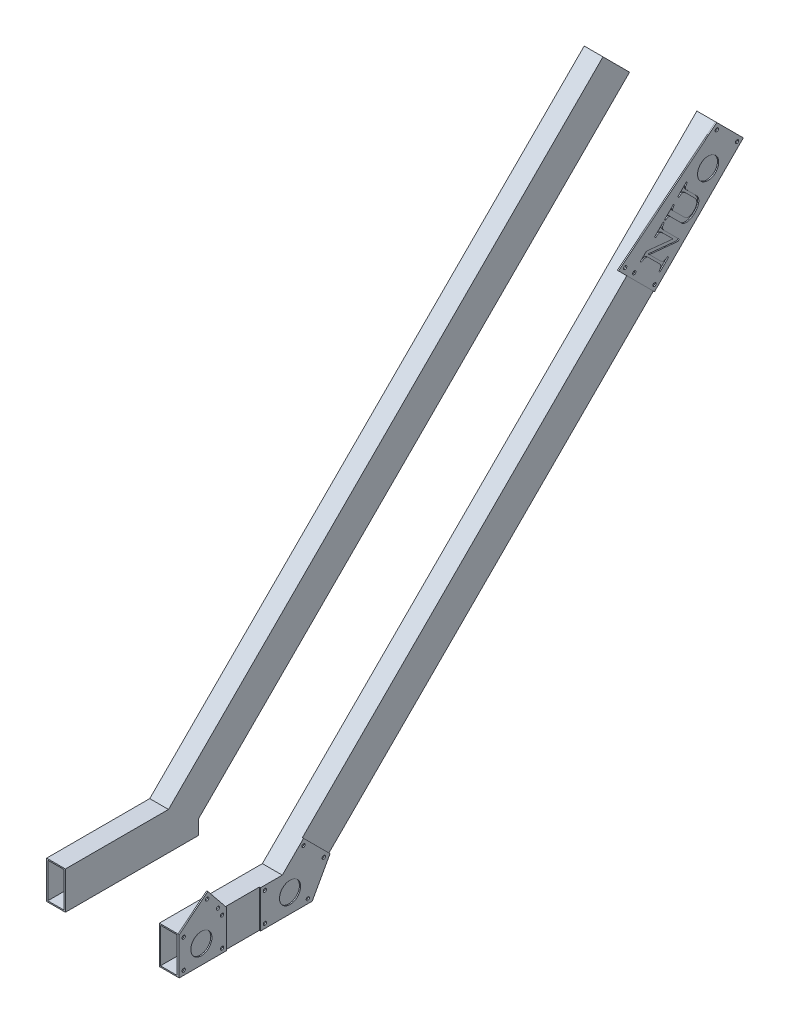
from build123d import *

# Parameters (mm, degrees)
HEEL_GUSSET_EXTRUSION_DEPTH     = 1.5875
SKETCH2_R                       = 14.2875
SKETCH2_R_2                     = 2.25
HEEL_GUSSET_CUT_EXTRUSION_DEPTH = 98
TOE_GUSSET_EXTRUSION_DEPTH      = 1.5875
SKETCH4_R                       = 14.2875
SKETCH4_R_2                     = 2.25
TOE_GUSSET_CUT_EXTRUSION_DEPTH  = 42.5875
KNEE_GUSSET_EXTRUSION_DEPTH     = 1.5875
SKETCH6_R                       = 14.2875
SKETCH6_R_2                     = 2.25
KNEE_GUSSET_CUT_EXTRUSION_DEPTH = 133.5875
BOTTOM_2X1_DEPTH                = 30
BOTTOM_2X1_DEPTH_BACK           = 150
SKETCH7_W                       = 25.4
SKETCH7_H                       = 50.8
SKETCH7_W_2                     = 22.225
SKETCH7_H_2                     = 47.625
TOP_KNEE_SHAFT_W                = 50.8
TOP_KNEE_SHAFT_H                = 25.4
TOP_KNEE_SHAFT_W_2              = 47.625
TOP_KNEE_SHAFT_H_2              = 22.225
BOSS_EXTRUDE2_DEPTH             = 850


with BuildPart() as part:
    # Sketch1 → Heel Gusset Extrusion (new body)
    with BuildSketch(Plane(origin=(88.9, 0, 0), x_dir=(0, 0, -1), z_dir=(1, 0, 0))):
        Polygon((80, -25.4), (150, -25.4), (174.145793616, 18.224769132), (138.224769132, 54.145793616), (109.478975516, 25.4), (80, 25.4), align=None)
    extrude(amount=HEEL_GUSSET_EXTRUSION_DEPTH)

    # Sketch2 → Heel Gusset Cut Extrusion (cut)
    with BuildSketch(Plane(origin=(76.2, 0, 0), x_dir=(0, 0, -1), z_dir=(1, 0, 0))):
        with Locations((120, 0)):
            Circle(SKETCH2_R)
        with Locations((138.224769132, 45.660512242)):
            Circle(SKETCH2_R_2)
        with Locations((165.660512242, 18.224769132)):
            Circle(SKETCH2_R_2)
        with Locations((86, 19.4)):
            Circle(SKETCH2_R_2)
        with Locations((86, -19.4)):
            Circle(SKETCH2_R_2)
        with Locations((144, -19.4)):
            Circle(SKETCH2_R_2)
    extrude(amount=HEEL_GUSSET_CUT_EXTRUSION_DEPTH, mode=Mode.SUBTRACT)



with BuildPart() as body_2:
    # Sketch3 → Toe Gusset Extrusion (new body)
    with BuildSketch(Plane(origin=(88.9, 0, 0), x_dir=(0, 0, -1), z_dir=(1, 0, 0))):
        Polygon((8.710787264, 56.688421729), (-30, 25.4), (-30, -25.4), (34, -25.4), (34, 25.4), align=None)
    extrude(amount=TOE_GUSSET_EXTRUSION_DEPTH)

    # Sketch4 → Toe Gusset Cut Extrusion (cut)
    with BuildSketch(Plane(origin=(76.2, 0, 0), x_dir=(0, 0, -1), z_dir=(1, 0, 0))):
        Circle(SKETCH4_R)
        with Locations((28, 19.4)):
            Circle(SKETCH4_R_2)
        with Locations((28, -19.4)):
            Circle(SKETCH4_R_2)
        with Locations((22.42887895, 30.171120686)):
            Circle(SKETCH4_R_2)
        with Locations((7.816066327, 48.250443627)):
            Circle(SKETCH4_R_2)
        with Locations((-24, -19.4)):
            Circle(SKETCH4_R_2)
        with Locations((-24, 19.4)):
            Circle(SKETCH4_R_2)
    extrude(amount=TOE_GUSSET_CUT_EXTRUSION_DEPTH, mode=Mode.SUBTRACT)


with BuildPart() as body_3:
    # Sketch5 → Knee Gusset Extrusion (new body)
    with BuildSketch(Plane(origin=(88.9, 0, 0), x_dir=(0, 0, -1), z_dir=(1, 0, 0))):
        Polygon((697.442069995, 613.363094479), (733.363094479, 577.442069995), (613.154941677, 457.233917193), (577.233917193, 493.154941677), (564.487646725, 505.901212145), align=None)
    extrude(amount=KNEE_GUSSET_EXTRUSION_DEPTH)

    # Sketch6 → Knee Gusset Cut Extrusion (cut)
    with BuildSketch(Plane(origin=(76.2, 0, 0), x_dir=(0, 0, -1), z_dir=(1, 0, 0))):
        with Locations((685.685424949, 565.685424949)):
            Circle(SKETCH6_R)
        with Locations((697.442069995, 604.877813105)):
            Circle(SKETCH6_R_2)
        with Locations((724.877813105, 577.442069995)):
            Circle(SKETCH6_R_2)
        with Locations((613.154941677, 465.719198567)):
            Circle(SKETCH6_R_2)
        with Locations((585.719198567, 493.154941677)):
            Circle(SKETCH6_R_2)
        with Locations((573.446580696, 505.427559549)):
            Circle(SKETCH6_R_2)
        with BuildLine():
            add(Edge.make_bspline(
                [(626.283784571, 531.747742034), (626.18476912, 531.633237155), (625.962022179, 531.375644922), (625.626237185, 530.918834739), (625.25138938, 530.3504036), (624.838610258, 529.714861229), (624.445802904, 529.065306723), (624.133069792, 528.459297066), (623.878562556, 527.946916437), (623.777618917, 527.617447402), (623.732326238, 527.469617034)],
                knots=[0, 0, 0, 0, 0.725463405, 1.632015524, 2.714952311, 3.989355048, 5.26524501, 6.350630696, 7.25993995, 8, 8, 8, 8], degree=3))
            add(Edge.make_bspline(
                [(623.732326238, 527.469617034), (623.703530931, 527.264134905), (623.643492561, 526.835703552), (623.772177185, 526.1529637), (624.061557775, 525.437957682), (624.512217524, 524.683291323), (625.105457958, 523.886348598), (625.819968772, 523.035442476), (626.634543073, 522.112536965), (627.2389781, 521.500356546), (627.555659571, 521.179617034)],
                knots=[0, 0, 0, 0, 0.650688799, 1.356689678, 2.157172564, 3.075778814, 4.119480805, 5.287640336, 6.578914174, 8, 8, 8, 8], degree=3))
            Line((627.555659571, 521.179617034), (646.572117904, 502.1631587))
            Line((646.572117904, 502.1631587), (644.806909571, 500.397950367))
            Line((644.806909571, 500.397950367), (606.157326238, 504.252117034))
            Line((606.157326238, 504.252117034), (619.554409571, 490.8550337))
            add(Edge.make_bspline(
                [(619.554409571, 490.8550337), (619.910944108, 490.504768306), (620.580485438, 489.846999888), (621.570347843, 488.971663238), (622.463641293, 488.258819131), (623.279272779, 487.711943052), (624.025892905, 487.310770024), (624.728888336, 487.066437289), (625.383198663, 486.909879006), (625.805202574, 486.934958494), (626.006284571, 486.9469087)],
                knots=[0, 0, 0, 0, 1.546081858, 2.903409339, 4.086612414, 5.078779751, 5.939243736, 6.698582645, 7.379883472, 8, 8, 8, 8], degree=3))
            add(Edge.make_bspline(
                [(626.006284571, 486.9469087), (626.172119348, 486.972278101), (626.552278043, 487.030434772), (627.164889568, 487.277190829), (627.890210481, 487.640981197), (628.683214639, 488.105159548), (629.448742054, 488.592212392), (630.103116655, 489.024749487), (630.605103235, 489.36074646), (630.863967709, 489.583875069), (630.970451238, 489.6756587)],
                knots=[0, 0, 0, 0, 0.70275794, 1.610998294, 2.754903516, 4.113646974, 5.467022005, 6.565581722, 7.409954109, 8, 8, 8, 8], degree=3))
            Line((630.970451238, 489.6756587), (632.273159571, 488.372950367))
            Line((632.273159571, 488.372950367), (620.494826238, 476.594617034))
            Line((620.494826238, 476.594617034), (619.192117904, 477.897325367))
            add(Edge.make_bspline(
                [(619.192117904, 477.897325367), (619.288579824, 478.014451556), (619.511548256, 478.28518474), (619.851268754, 478.772555951), (620.256060932, 479.384493084), (620.678952211, 480.090094675), (621.088170756, 480.787453187), (621.409889622, 481.399151004), (621.625002645, 481.881928832), (621.69265312, 482.171916948), (621.720451238, 482.291075367)],
                knots=[0, 0, 0, 0, 0.714187218, 1.650819347, 2.795016477, 4.168543286, 5.523564251, 6.600347029, 7.424871484, 8, 8, 8, 8], degree=3))
            add(Edge.make_bspline(
                [(621.720451238, 482.291075367), (621.741833669, 482.496564716), (621.785021988, 482.911612904), (621.690597888, 483.55247132), (621.466415779, 484.194261462), (621.189124324, 484.734590612), (620.892084919, 485.186198357), (620.619240177, 485.580203078), (620.273789022, 485.998332413), (619.8904193, 486.467038485), (619.438148063, 486.964122571), (618.942772007, 487.511567431), (618.384169234, 488.08910677), (617.992629789, 488.483882195), (617.789201238, 488.688992034)],
                knots=[0, 0, 0, 0, 0.954113466, 1.927122102, 2.969790135, 4.093050465, 4.730288298, 5.473356475, 6.311750304, 7.241419362, 8.278364396, 9.424166478, 10.661697852, 12, 12, 12, 12], degree=3))
            Line((617.789201238, 488.688992034), (604.993367904, 501.484825367))
            add(Edge.make_bspline(
                [(604.993367904, 501.484825367), (604.697575712, 501.752960135), (604.09479709, 502.299377214), (603.184612924, 502.768850142), (602.435185964, 503.073004975), (601.878433987, 503.219279888), (601.339072884, 503.297183214), (600.987782575, 503.28106551), (600.815451238, 503.2731587)],
                knots=[0, 0, 0, 0, 1.532670844, 3.123345518, 3.910287659, 4.647577312, 5.336546431, 6, 6, 6, 6], degree=3))
            add(Edge.make_bspline(
                [(600.815451238, 503.2731587), (600.586021548, 503.24140033), (600.109537339, 503.175443907), (599.374402357, 502.98570074), (598.603379871, 502.6939537), (597.810218946, 502.344418989), (597.057509928, 501.949300207), (596.374077537, 501.573901785), (595.807719035, 501.186496471), (595.479615017, 500.916544436), (595.327117904, 500.791075367)],
                knots=[0, 0, 0, 0, 0.911473382, 1.892966314, 2.981176775, 4.154254047, 5.303532387, 6.327487696, 7.222645008, 8, 8, 8, 8], degree=3))
            Line((595.327117904, 500.791075367), (594.032117904, 502.086075367))
            Line((594.032117904, 502.086075367), (602.226076238, 510.2800337))
            Line((602.226076238, 510.2800337), (638.185451238, 506.618575367))
            Line((638.185451238, 506.618575367), (625.821284571, 518.982742034))
            add(Edge.make_bspline(
                [(625.821284571, 518.982742034), (625.461895262, 519.335217253), (624.786680767, 519.997441676), (623.7949158, 520.882691191), (622.885386847, 521.588528501), (622.063135354, 522.132113101), (621.316243132, 522.521343355), (620.640758318, 522.763520475), (620.025472579, 522.899846132), (619.642006809, 522.85177656), (619.461909571, 522.829200367)],
                knots=[0, 0, 0, 0, 1.578073432, 2.964857417, 4.165232815, 5.184084504, 6.052322309, 6.796310792, 7.434679395, 8, 8, 8, 8], degree=3))
            add(Edge.make_bspline(
                [(619.461909571, 522.829200367), (619.293676074, 522.781282462), (618.921451551, 522.675261843), (618.335464638, 522.415611689), (617.658016348, 522.078000252), (616.931306312, 521.658032526), (616.20980238, 521.23065472), (615.574642153, 520.810271897), (615.048873274, 520.439265249), (614.748279866, 520.189448025), (614.613367904, 520.077325367)],
                knots=[0, 0, 0, 0, 0.748119284, 1.655249091, 2.737561554, 3.988776058, 5.247127191, 6.327201157, 7.249216494, 8, 8, 8, 8], degree=3))
            Line((614.613367904, 520.077325367), (613.318367904, 521.372325367))
            Line((613.318367904, 521.372325367), (624.988784571, 533.042742034))
            Line((624.988784571, 533.042742034), (626.283784571, 531.747742034))
        make_face()
        with BuildLine():
            add(Edge.make_bspline(
                [(657.604206668, 563.06816413), (657.50531789, 562.95614133), (657.287679711, 562.709597296), (656.957871575, 562.277155871), (656.573569787, 561.766130042), (656.164443972, 561.184754329), (655.762527124, 560.577822143), (655.432867225, 559.96462283), (655.16055493, 559.384325585), (655.045723456, 558.992095743), (654.991081668, 558.805455797)],
                knots=[0, 0, 0, 0, 0.711799156, 1.566554612, 2.5900989, 3.758614379, 4.954016207, 6.055234405, 7.074596302, 8, 8, 8, 8], degree=3))
            add(Edge.make_bspline(
                [(654.991081668, 558.805455797), (654.96484205, 558.610024253), (654.909572125, 558.19837623), (655.052980316, 557.536779742), (655.335787264, 556.825698028), (655.786950678, 556.067755175), (656.366388192, 555.264041275), (657.06697606, 554.423712496), (657.84957553, 553.520655104), (658.4330684, 552.930900777), (658.737331668, 552.623372464)],
                knots=[0, 0, 0, 0, 0.630343996, 1.327727625, 2.14457276, 3.089112149, 4.15600778, 5.331150197, 6.608324105, 8, 8, 8, 8], degree=3))
            Line((658.737331668, 552.623372464), (670.030040001, 541.33066413))
            add(Edge.make_bspline(
                [(670.030040001, 541.33066413), (670.369318192, 540.96931117), (671.028026828, 540.267744366), (671.823561608, 539.09279456), (672.424104651, 537.867997864), (672.826560094, 536.593197023), (673.043693678, 535.292700501), (673.12099097, 533.982796135), (673.059625407, 532.661685782), (672.890427522, 531.793978531), (672.805040001, 531.356080797)],
                knots=[0, 0, 0, 0, 1.096769787, 2.129378636, 3.12993495, 4.109328749, 5.079831248, 6.043565211, 7.012664283, 8, 8, 8, 8], degree=3))
            add(Edge.make_bspline(
                [(672.805040001, 531.356080797), (672.696846894, 530.93243771), (672.480978173, 530.087177845), (672.026488277, 528.866246477), (671.496105905, 527.686080269), (670.869945043, 526.568212466), (670.185042906, 525.508582704), (669.461524671, 524.515598073), (668.70664255, 523.589689568), (668.163377651, 523.025006063), (667.894831668, 522.745872464)],
                knots=[0, 0, 0, 0, 1.045021202, 2.085044008, 3.110809235, 4.136795311, 5.145859193, 6.1266866, 7.07398621, 8, 8, 8, 8], degree=3))
            add(Edge.make_bspline(
                [(667.894831668, 522.745872464), (667.468284097, 522.334305853), (666.635846489, 521.531104644), (665.333015279, 520.450032097), (664.019171309, 519.51845916), (662.70055901, 518.741921935), (661.397527492, 518.097389039), (660.116016587, 517.594798831), (658.860350755, 517.220500568), (658.022248879, 517.079772696), (657.611915001, 517.010872464)],
                knots=[0, 0, 0, 0, 1.187406935, 2.31730821, 3.388671346, 4.411192297, 5.38058751, 6.298447692, 7.166921615, 8, 8, 8, 8], degree=3))
            add(Edge.make_bspline(
                [(657.611915001, 517.010872464), (657.219235568, 516.967471725), (656.453047658, 516.882789111), (655.315848306, 516.926295468), (654.222668585, 517.054023136), (653.179774733, 517.327042347), (652.201161077, 517.716529744), (651.281773794, 518.191436555), (650.44213167, 518.784340762), (649.939932651, 519.245808459), (649.687748334, 519.47753913)],
                knots=[0, 0, 0, 0, 1.100464238, 2.147202838, 3.165915912, 4.165414661, 5.143591158, 6.098895442, 7.04534112, 8, 8, 8, 8], degree=3))
            Line((649.687748334, 519.47753913), (634.325040001, 534.840247464))
            add(Edge.make_bspline(
                [(634.325040001, 534.840247464), (634.118566726, 535.030626141), (633.732735922, 535.386381423), (633.137197967, 535.655493606), (632.645732603, 535.760153917), (632.230780504, 535.739145074), (631.76690786, 535.673081136), (631.448825208, 535.577137282), (631.280248334, 535.52628913)],
                knots=[0, 0, 0, 0, 1.50945907, 2.820683726, 3.471536488, 4.207609481, 5.050072085, 6, 6, 6, 6], degree=3))
            add(Edge.make_bspline(
                [(631.280248334, 535.52628913), (631.009138049, 535.421102816), (630.410698484, 535.188918144), (629.577345515, 534.654672961), (628.778437485, 534.105561968), (628.295341668, 533.71728603), (628.081290001, 533.545247464)],
                knots=[0, 0, 0, 0, 0.921147977, 2.033310521, 3.128592823, 4, 4, 4, 4], degree=3))
            Line((628.081290001, 533.545247464), (626.786290001, 534.840247464))
            Line((626.786290001, 534.840247464), (638.749623334, 546.803580797))
            Line((638.749623334, 546.803580797), (640.044623334, 545.508580797))
            add(Edge.make_bspline(
                [(640.044623334, 545.508580797), (639.948601488, 545.401478082), (639.746482039, 545.176034157), (639.443486618, 544.79818828), (639.116140443, 544.37230261), (638.781358493, 543.912574479), (638.472748493, 543.455220421), (638.188701804, 543.051637111), (637.975409847, 542.694432153), (637.850081138, 542.476763087), (637.793790001, 542.378997464)],
                knots=[0, 0, 0, 0, 0.893916814, 1.881634042, 3.009219562, 4.232705447, 5.415488858, 6.438719388, 7.298753957, 8, 8, 8, 8], degree=3))
            add(Edge.make_bspline(
                [(637.793790001, 542.378997464), (637.727421803, 542.231808143), (637.601297901, 541.952094483), (637.492704708, 541.519331916), (637.491103785, 541.101031571), (637.623553615, 540.582558215), (637.945547822, 539.982659426), (638.304096068, 539.579179684), (638.487540001, 539.372747464)],
                knots=[0, 0, 0, 0, 0.86893304, 1.651291271, 2.384983755, 3.096801689, 4.51463751, 6, 6, 6, 6], degree=3))
            Line((638.487540001, 539.372747464), (652.840456668, 525.019830797))
            add(Edge.make_bspline(
                [(652.840456668, 525.019830797), (653.211329525, 524.675284098), (653.975232967, 523.965605822), (655.051519181, 523.195928969), (656.002045427, 522.662736645), (656.768833306, 522.337625674), (657.578299893, 522.094563745), (658.137365211, 521.999959489), (658.421290001, 521.95191413)],
                knots=[0, 0, 0, 0, 1.404697551, 2.893318494, 3.659687318, 4.426885815, 5.201084203, 6, 6, 6, 6], degree=3))
            add(Edge.make_bspline(
                [(658.421290001, 521.95191413), (658.724297017, 521.929363902), (659.338291214, 521.883669551), (660.27971707, 521.948097581), (661.240373666, 522.144322279), (662.244929352, 522.43072874), (663.285922136, 522.90540146), (664.355643416, 523.588751999), (665.473322891, 524.46979357), (666.194771348, 525.162082534), (666.576706668, 525.528580797)],
                knots=[0, 0, 0, 0, 0.788940443, 1.598658875, 2.442011267, 3.333575882, 4.30784546, 5.402802075, 6.625041594, 8, 8, 8, 8], degree=3))
            add(Edge.make_bspline(
                [(666.576706668, 525.528580797), (666.92473688, 525.892979728), (667.595260553, 526.595039781), (668.460789216, 527.696970427), (669.159166734, 528.789355406), (669.678889458, 529.877158201), (670.04875982, 530.942015001), (670.293559435, 531.97717286), (670.412048717, 532.985432268), (670.378140887, 533.645320961), (670.361498334, 533.969205797)],
                knots=[0, 0, 0, 0, 1.265613172, 2.438361849, 3.51490655, 4.516988949, 5.460338496, 6.342064128, 7.186256265, 8, 8, 8, 8], degree=3))
            add(Edge.make_bspline(
                [(670.361498334, 533.969205797), (670.327900838, 534.262842538), (670.261691037, 534.841505604), (670.079647764, 535.679984776), (669.812224527, 536.468280358), (669.479815043, 537.206513013), (669.092739991, 537.905349991), (668.652040452, 538.556300537), (668.174275029, 539.175684745), (667.813706722, 539.548123381), (667.632748334, 539.73503913)],
                knots=[0, 0, 0, 0, 1.088265488, 2.144619379, 3.153255501, 4.148840658, 5.123281855, 6.091914249, 7.042389155, 8, 8, 8, 8], degree=3))
            Line((667.632748334, 539.73503913), (656.979831668, 550.387955797))
            add(Edge.make_bspline(
                [(656.979831668, 550.387955797), (656.650876725, 550.706634263), (656.025039162, 551.312920803), (655.09046129, 552.139637781), (654.201083114, 552.823677892), (653.369200819, 553.37755849), (652.601500317, 553.791548417), (651.903361149, 554.06578063), (651.263182608, 554.196003443), (650.867236714, 554.148640621), (650.682123334, 554.126497464)],
                knots=[0, 0, 0, 0, 1.457529613, 2.772953556, 3.968543238, 5.025438667, 5.950917291, 6.737637765, 7.409818002, 8, 8, 8, 8], degree=3))
            add(Edge.make_bspline(
                [(650.682123334, 554.126497464), (650.480066307, 554.074916569), (650.054384251, 553.966248923), (649.414655569, 553.689764595), (648.727515288, 553.348124923), (648.037813866, 552.913018091), (647.376713829, 552.469593235), (646.780176881, 552.060544709), (646.291953696, 551.686172834), (646.002504925, 551.444804607), (645.872123334, 551.336080797)],
                knots=[0, 0, 0, 0, 0.891762213, 1.878713045, 2.976092237, 4.17633605, 5.366551064, 6.386087247, 7.273016394, 8, 8, 8, 8], degree=3))
            Line((645.872123334, 551.336080797), (644.577123334, 552.631080797))
            Line((644.577123334, 552.631080797), (656.309206668, 564.36316413))
            Line((656.309206668, 564.36316413), (657.604206668, 563.06816413))
        make_face()
    extrude(amount=KNEE_GUSSET_CUT_EXTRUSION_DEPTH, mode=Mode.SUBTRACT)


with BuildPart() as part_1:
    add(part.part)

    add(body_2.part)  # Bottom 2x1 merges body 2
    # Sketch7 → Bottom 2x1 (add, two sides: drawn at the far end of the back side and taken through both)
    # profile 1 of 2: a face of its own
    with BuildSketch(Plane.XY.offset(-BOTTOM_2X1_DEPTH_BACK)):
        with Locations((-76.2, 0)):
            Rectangle(SKETCH7_W, SKETCH7_H)
        with Locations((-76.2, 0)):
            Rectangle(SKETCH7_W_2, SKETCH7_H_2, mode=Mode.SUBTRACT)
    # profile 2 of 2: a face of its own
    with BuildSketch(Plane.XY.offset(-BOTTOM_2X1_DEPTH_BACK)):
        with Locations((76.2, 0)):
            Rectangle(SKETCH7_W, SKETCH7_H)
        with Locations((76.2, 0)):
            Rectangle(SKETCH7_W_2, SKETCH7_H_2, mode=Mode.SUBTRACT)
    extrude(amount=BOTTOM_2X1_DEPTH + BOTTOM_2X1_DEPTH_BACK)


    add(body_3.part)  # Boss-Extrude2 merges body 3
    # Top Knee Shaft → Boss-Extrude2 (add)
    # profile 1 of 2: a face of its own
    with BuildSketch(Plane(origin=(0, 655.402582237, -655.402582237), x_dir=(0, -0.7071067811865519, -0.7071067811865431), z_dir=(0, 0.7071067811865431, -0.7071067811865519))):
        with Locations((84.852813742, 76.2)):
            Rectangle(TOP_KNEE_SHAFT_W, TOP_KNEE_SHAFT_H)
        with Locations((84.852813742, 76.2)):
            Rectangle(TOP_KNEE_SHAFT_W_2, TOP_KNEE_SHAFT_H_2, mode=Mode.SUBTRACT)
    # profile 2 of 2: a face of its own
    with BuildSketch(Plane(origin=(0, 655.402582237, -655.402582237), x_dir=(0, -0.7071067811865519, -0.7071067811865431), z_dir=(0, 0.7071067811865431, -0.7071067811865519))):
        with Locations((84.852813742, -76.2)):
            Rectangle(TOP_KNEE_SHAFT_W, TOP_KNEE_SHAFT_H)
        with Locations((84.852813742, -76.2)):
            Rectangle(TOP_KNEE_SHAFT_W_2, TOP_KNEE_SHAFT_H_2, mode=Mode.SUBTRACT)
    extrude(amount=-BOSS_EXTRUDE2_DEPTH)


solid = part_1.part
